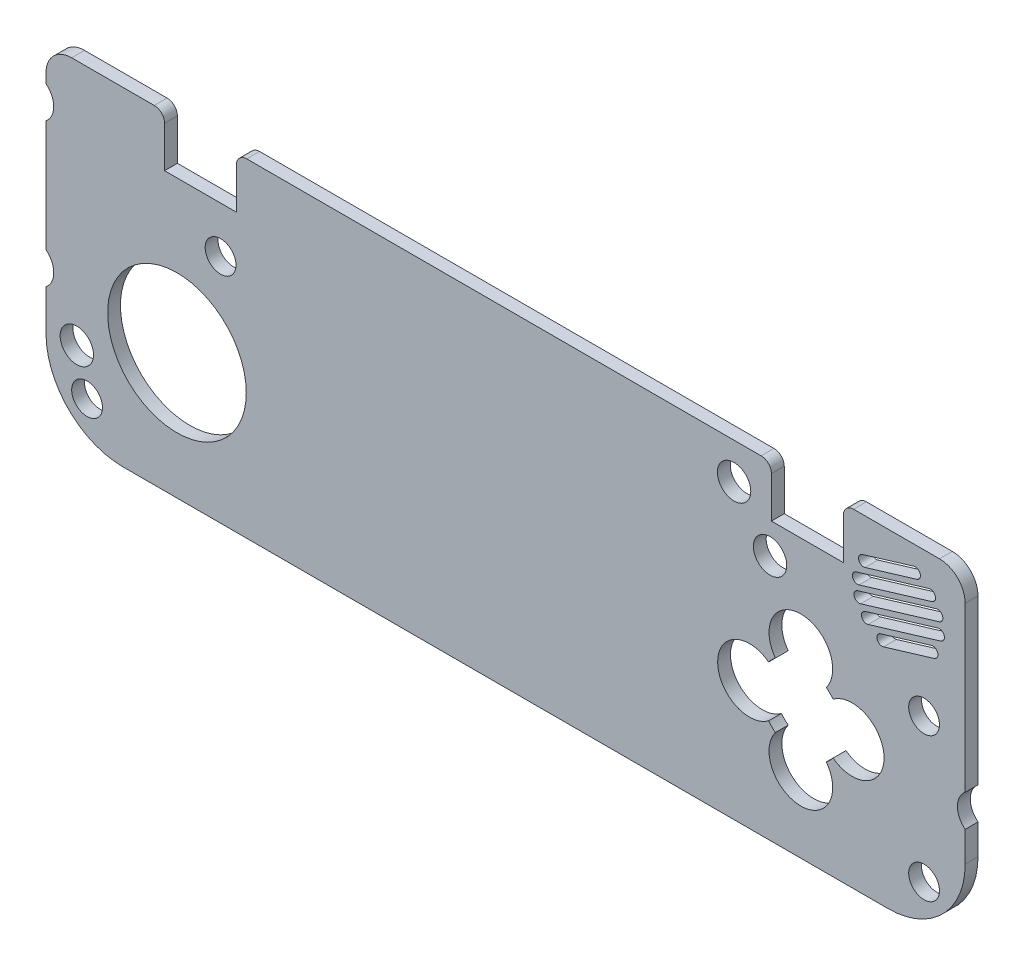
from build123d import *

# Parameters (mm, degrees)
BOSS_EXTRU_1_DEPTH       = 2.5
JOYSTICK_R               = 13.5
ENL_V_MAT_EXTRU_2_DEPTH  = 2.5
ESQUISSE2_W              = 14
ESQUISSE2_H              = 10
ENL_V_MAT_EXTRU_3_DEPTH  = 10
CONG_1_R                 = 2
CONG_2_R                 = 2
ESQUISSE3_W              = 14
ESQUISSE3_H              = 10
ENL_V_MAT_EXTRU_4_DEPTH  = 10
CONG_3_R                 = 2
CONG_4_R                 = 2
ENL_V_MAT_EXTRU_5_DEPTH  = 10
ENL_V_MAT_EXTRU_8_DEPTH  = 10
ESQUISSE5_R              = 3
ESQUISSE5_R_2            = 3.25
ENL_V_MAT_EXTRU_9_DEPTH  = 10
ESQUISSE6_R              = 4
ENL_V_MAT_EXTRU_11_DEPTH = 10


with BuildPart() as part:
    # Esquisse1 → Boss.-Extru.1 (new body)
    with BuildSketch(Plane.XY):
        with BuildLine():
            Line((-89.203921136, 33.34478673), (79.796078864, 33.34478673))
            ThreePointArc((79.796078864, 33.34478673), (83.33161277, 31.880320636), (84.796078864, 28.34478673))
            Line((84.796078864, 28.34478673), (84.796078864, -15.65521327))
            ThreePointArc((84.796078864, -15.65521327), (80.402680581, -26.261814988), (69.796078864, -30.65521327))
            Line((69.796078864, -30.65521327), (-79.203921136, -30.65521327))
            ThreePointArc((-79.203921136, -30.65521327), (-89.810522854, -26.261814988), (-94.203921136, -15.65521327))
            Line((-94.203921136, -15.65521327), (-94.203921136, 28.34478673))
            ThreePointArc((-94.203921136, 28.34478673), (-92.739455042, 31.880320636), (-89.203921136, 33.34478673))
        make_face()
    extrude(amount=BOSS_EXTRU_1_DEPTH)

    # Joystick → Enlèv. mat.-Extru.2 (cut)
    with BuildSketch(Plane.XY.offset(2.5)):
        with Locations((-68.703921136, -6.15521327)):
            Circle(JOYSTICK_R)
    extrude(amount=-ENL_V_MAT_EXTRU_2_DEPTH, mode=Mode.SUBTRACT)

    # Esquisse2 → Enlèv. mat.-Extru.3 (cut)
    with BuildSketch(Plane.XY.offset(2.5)):
        with Locations((54.066078864, 28.34478673)):
            Rectangle(ESQUISSE2_W, ESQUISSE2_H)
    extrude(amount=-ENL_V_MAT_EXTRU_3_DEPTH, mode=Mode.SUBTRACT)

    # Congé1
    cong_1_edges = [part.edges().sort_by_distance(p)[0] for p in [
        (47.066078864, 33.34478673, 1.25),
    ]]
    fillet(cong_1_edges, radius=CONG_1_R)

    # Congé2
    cong_2_edges = [part.edges().sort_by_distance(p)[0] for p in [
        (61.066078864, 33.34478673, 1.25),
    ]]
    fillet(cong_2_edges, radius=CONG_2_R)

    # Esquisse3 → Enlèv. mat.-Extru.4 (cut)
    with BuildSketch(Plane.XY.offset(2.5)):
        with Locations((-64.113921136, 28.34478673)):
            Rectangle(ESQUISSE3_W, ESQUISSE3_H)
    extrude(amount=-ENL_V_MAT_EXTRU_4_DEPTH, mode=Mode.SUBTRACT)

    # Congé3
    cong_3_edges = [part.edges().sort_by_distance(p)[0] for p in [
        (-71.113921136, 33.34478673, 1.25),
    ]]
    fillet(cong_3_edges, radius=CONG_3_R)

    # Congé4
    cong_4_edges = [part.edges().sort_by_distance(p)[0] for p in [
        (-57.113921136, 33.34478673, 1.25),
    ]]
    fillet(cong_4_edges, radius=CONG_4_R)

    # 12x12 Button → Enlèv. mat.-Extru.5 (cut)
    with BuildSketch(Plane.XY.offset(2.5)):
        with BuildLine():
            ThreePointArc((46.518078864, -0.6967139), (36.596078864, -5.65521327), (46.518078864, -10.61371264))
            ThreePointArc((46.518078864, -10.61371264), (47.139224614, -11.31206752), (47.837579494, -11.93321327))
            ThreePointArc((47.837579494, -11.93321327), (52.796078864, -21.85521327), (57.754578233, -11.93321327))
            ThreePointArc((57.754578233, -11.93321327), (58.452933113, -11.31206752), (59.074078864, -10.61371264))
            ThreePointArc((59.074078864, -10.61371264), (68.996078864, -5.65521327), (59.074078864, -0.6967139))
            ThreePointArc((59.074078864, -0.6967139), (58.452933113, 0.001640979), (57.754578233, 0.62278673))
            ThreePointArc((57.754578233, 0.62278673), (52.796078864, 10.54478673), (47.837579494, 0.62278673))
            ThreePointArc((47.837579494, 0.62278673), (47.139224614, 0.001640979), (46.518078864, -0.6967139))
        make_face()
    extrude(amount=-ENL_V_MAT_EXTRU_5_DEPTH, mode=Mode.SUBTRACT)

    # Esquisse4 → Enlèv. mat.-Extru.8 (cut)
    with BuildSketch(Plane.XY.offset(2.5)):
        with BuildLine():
            ThreePointArc((63.848163441, 19.991775112), (63.179574158, 18.745585572), (64.425763698, 18.076996289))
            Line((64.425763698, 18.076996289), (79.743994286, 22.697798347))
            ThreePointArc((79.743994286, 22.697798347), (80.412583569, 23.943987888), (79.166394029, 24.612577171))
            Line((79.166394029, 24.612577171), (63.848163441, 19.991775112))
        make_face()
        with BuildLine():
            ThreePointArc((63.539756046, 23.02230266), (62.871166763, 21.776113119), (64.117356303, 21.107523836))
            Line((64.117356303, 21.107523836), (78.325109436, 25.39334618))
            ThreePointArc((78.325109436, 25.39334618), (78.993698719, 26.639535721), (77.747509179, 27.308125004))
            Line((77.747509179, 27.308125004), (63.539756046, 23.02230266))
        make_face()
        with BuildLine():
            ThreePointArc((65.314724126, 17.237366416), (64.646138135, 15.991183011), (65.89232154, 15.32259702))
            Line((65.89232154, 15.32259702), (80.04522523, 19.591873823))
            ThreePointArc((80.04522523, 19.591873823), (80.713811222, 20.838057228), (79.467627817, 21.506643219))
            Line((79.467627817, 21.506643219), (65.314724126, 17.237366416))
        make_face()
        with BuildLine():
            ThreePointArc((64.732924902, 26.557541009), (64.064335619, 25.311351468), (65.31052516, 24.642762185))
            Line((65.31052516, 24.642762185), (75.37602861, 27.679059282))
            ThreePointArc((75.37602861, 27.679059282), (76.044617893, 28.925248822), (74.798428352, 29.593838105))
            Line((74.798428352, 29.593838105), (64.732924902, 26.557541009))
        make_face()
        with BuildLine():
            ThreePointArc((68.322797362, 14.963301678), (67.654208079, 13.717112138), (68.900397619, 13.048522855))
            Line((68.900397619, 13.048522855), (78.796465983, 16.033709218))
            ThreePointArc((78.796465983, 16.033709218), (79.465055266, 17.279898759), (78.218865725, 17.948488042))
            Line((78.218865725, 17.948488042), (68.322797362, 14.963301678))
        make_face()
    extrude(amount=-ENL_V_MAT_EXTRU_8_DEPTH, mode=Mode.SUBTRACT)

    # Esquisse5 → Enlèv. mat.-Extru.9 (cut)
    with BuildSketch(Plane.XY.offset(2.5)):
        with Locations((76.796078864, -22.65521327)):
            Circle(ESQUISSE5_R)
        with Locations((-86.203921136, -22.65521327)):
            Circle(ESQUISSE5_R)
        with Locations((76.796078864, 5.34478673)):
            Circle(ESQUISSE5_R)
        with Locations((-60.203921136, 14.34478673)):
            Circle(ESQUISSE5_R)
        with Locations((-88.203921136, -14.65521327)):
            Circle(ESQUISSE5_R_2)
        with Locations((39.796078864, 26.34478673)):
            Circle(ESQUISSE5_R_2)
        with Locations((46.796078864, 17.34478673)):
            Circle(ESQUISSE5_R_2)
    extrude(amount=-ENL_V_MAT_EXTRU_9_DEPTH, mode=Mode.SUBTRACT)

    # Esquisse6 → Enlèv. mat.-Extru.11 (cut)
    with BuildSketch(Plane.XY.offset(2.5)):
        with Locations((-96.703921136, -4.65521327)):
            Circle(ESQUISSE6_R)
        with Locations((-96.703921136, 23.34478673)):
            Circle(ESQUISSE6_R)
        with Locations((87.296078864, -6.65521327)):
            Circle(ESQUISSE6_R)
    extrude(amount=-ENL_V_MAT_EXTRU_11_DEPTH, mode=Mode.SUBTRACT)


solid = part.part
